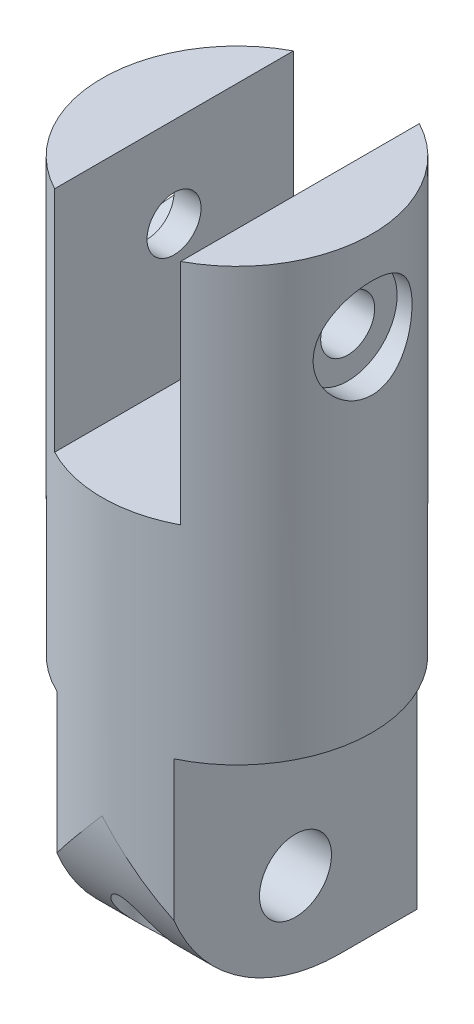
from build123d import *

# Parameters (mm, degrees)
SKETCH1_W           = 6.5
SKETCH1_H           = 14
BOSS_EXTRUDE1_DEPTH = 15
FILLET1_R           = 10
SKETCH2_R           = 2
CUT_EXTRUDE1_DEPTH  = 18.783419244
SKETCH4_R           = 7.5
BOSS_EXTRUDE2_DEPTH = 24
SKETCH6_W           = 7
SKETCH6_H           = 12.68
CUT_EXTRUDE2_DEPTH  = 36.245567097
CUT_EXTRUDE3_DEPTH  = 30.278831944
SKETCH8_R           = 1.5
CUT_EXTRUDE4_DEPTH  = 21
SKETCH9_R           = 2.75
CUT_EXTRUDE5_DEPTH  = 10
CUT_EXTRUDE6_DEPTH  = 10
SKETCH11_R          = 1.25
CUT_EXTRUDE7_DEPTH  = 24


with BuildPart() as part:
    # Sketch1 → Boss-Extrude1 (new body)
    with BuildSketch(Plane.XY):
        Rectangle(SKETCH1_W, SKETCH1_H)
    extrude(amount=BOSS_EXTRUDE1_DEPTH)

    # Fillet1
    fillet1_edges = [part.edges().sort_by_distance(p)[0] for p in [
        (0, -7, 15),
    ]]
    fillet(fillet1_edges, radius=FILLET1_R)

    # Sketch2 → Cut-Extrude1 (cut, through all)
    with BuildSketch(Plane(origin=(3.25, 0, 0), x_dir=(0, 0, -1), z_dir=(1, 0, 0))):
        with Locations((-7.5, -2)):
            Circle(SKETCH2_R)
    extrude(amount=-CUT_EXTRUDE1_DEPTH, mode=Mode.SUBTRACT)

    # Sketch4 → Boss-Extrude2 (add)
    with BuildSketch(Plane(origin=(0, 7, 0), x_dir=(1, 0, 0), z_dir=(0, 1, 0))):
        with Locations((0, -7.5)):
            Circle(SKETCH4_R)
    extrude(amount=BOSS_EXTRUDE2_DEPTH)

    # Sketch6 → Cut-Extrude2 (cut, through all)
    with BuildSketch(Plane(origin=(0, 0, 0), x_dir=(-1, 0, 0), z_dir=(0, 0, -1))):
        with Locations((0, 24.66)):
            Rectangle(SKETCH6_W, SKETCH6_H)
    extrude(amount=-CUT_EXTRUDE2_DEPTH, mode=Mode.SUBTRACT)

    # Sketch7 → Cut-Extrude3 (cut, through all)
    with BuildSketch(Plane(origin=(0, 7, 0), x_dir=(1, 0, 0), z_dir=(0, 1, 0))):
        with BuildLine():
            ThreePointArc((0, -15), (-1.666673801, -14.812468697), (-3.25, -14.259252917))
            Line((-3.25, -14.259252917), (-3.25, -15))
            Line((-3.25, -15), (0, -15))
        make_face()
        with BuildLine():
            ThreePointArc((3.25, -14.259252917), (1.666673801, -14.812468697), (0, -15))
            Line((0, -15), (3.25, -15))
            Line((3.25, -15), (3.25, -14.259252917))
        make_face()
        with BuildLine():
            ThreePointArc((-3.25, -0.740747083), (-1.666673801, -0.187531303), (0, 0))
            Line((0, 0), (-3.25, 0))
            Line((-3.25, 0), (-3.25, -0.740747083))
        make_face()
        with BuildLine():
            Line((3.25, 0), (0, 0))
            ThreePointArc((0, 0), (1.666673801, -0.187531303), (3.25, -0.740747083))
            Line((3.25, -0.740747083), (3.25, 0))
        make_face()
    extrude(amount=-CUT_EXTRUDE3_DEPTH, mode=Mode.SUBTRACT)

    # Sketch8 → Cut-Extrude4 (cut, symmetric)
    with BuildSketch(Plane(origin=(-3.5, 0, 0), x_dir=(0, 0, -1), z_dir=(1, 0, 0))):
        with Locations((-7.5, 26)):
            Circle(SKETCH8_R)
    extrude(amount=CUT_EXTRUDE4_DEPTH, both=True, mode=Mode.SUBTRACT)

    # Sketch9 → Cut-Extrude5 (cut)
    with BuildSketch(Plane.ZY.offset(-6.15)):
        with Locations((7.5, 26)):
            Circle(SKETCH9_R)
    extrude(amount=-CUT_EXTRUDE5_DEPTH, mode=Mode.SUBTRACT)

    # Sketch10 → Cut-Extrude6 (cut)
    with BuildSketch(Plane(origin=(-5, 0, 0), x_dir=(0, 0, -1), z_dir=(1, 0, 0))):
        Polygon((-7.5, 29.75277675), (-10.75, 27.876388375), (-10.75, 24.123611625), (-7.5, 22.24722325), (-4.25, 24.123611625), (-4.25, 27.876388375), align=None)
    extrude(amount=-CUT_EXTRUDE6_DEPTH, mode=Mode.SUBTRACT)

    # Sketch11 → Cut-Extrude7 (cut)
    with BuildSketch(Plane.XZ.offset(7)):
        with Locations((0, 3)):
            Circle(SKETCH11_R)
        with Locations((0, 12.74882624)):
            Circle(SKETCH11_R)
    extrude(amount=-CUT_EXTRUDE7_DEPTH, mode=Mode.SUBTRACT)


solid = part.part
